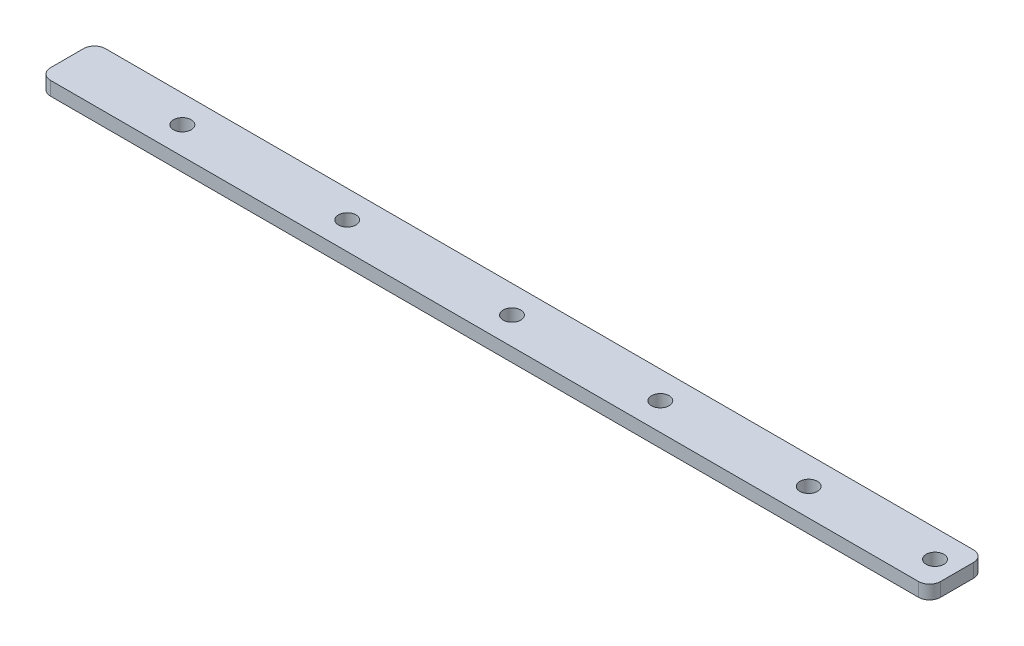
from build123d import *

# Parameters (mm, degrees)
SKETCH1_W           = 205.74
SKETCH1_H           = 12.7
BOSS_EXTRUDE1_DEPTH = 3.175
FILLET1_R           = 2.54
CUT_EXTRUDE1_REACH  = 105.115
SKETCH2_R           = 2.032


with BuildPart() as part:
    # Sketch1 → Boss-Extrude1 (new body)
    with BuildSketch(Plane(origin=(0, 0, 0), x_dir=(1, 0, 0), z_dir=(0, 1, 0))):
        Rectangle(SKETCH1_W, SKETCH1_H)
    extrude(amount=BOSS_EXTRUDE1_DEPTH)

    # Fillet1
    fillet1_edges = [part.edges().sort_by_distance(p)[0] for p in [
        (102.87, 1.5875, -6.35),
        (102.87, 1.5875, 6.35),
        (-102.87, 1.5875, 6.35),
        (-102.87, 1.5875, -6.35),
    ]]
    fillet(fillet1_edges, radius=FILLET1_R)

    # Sketch2 → Cut-Extrude1 (cut, up to next)
    with BuildSketch(Plane(origin=(0, 3.175, 0), x_dir=(1, 0, 0), z_dir=(0, 1, 0)), mode=Mode.PRIVATE) as cut_extrude1_sk1:
        with Locations((-76.2, 0)):
            Circle(SKETCH2_R)
    cut_extrude1_tool1 = extrude(cut_extrude1_sk1.sketch, amount=-CUT_EXTRUDE1_REACH, mode=Mode.PRIVATE) & part.part
    # Sketch2 → Cut-Extrude1 (cut, up to next)
    with BuildSketch(Plane(origin=(0, 3.175, 0), x_dir=(1, 0, 0), z_dir=(0, 1, 0)), mode=Mode.PRIVATE) as cut_extrude1_sk2:
        Circle(SKETCH2_R)
    cut_extrude1_tool2 = extrude(cut_extrude1_sk2.sketch, amount=-CUT_EXTRUDE1_REACH, mode=Mode.PRIVATE) & part.part
    # Sketch2 → Cut-Extrude1 (cut, up to next)
    with BuildSketch(Plane(origin=(0, 3.175, 0), x_dir=(1, 0, 0), z_dir=(0, 1, 0)), mode=Mode.PRIVATE) as cut_extrude1_sk3:
        with Locations((-38.1, 0)):
            Circle(SKETCH2_R)
    cut_extrude1_tool3 = extrude(cut_extrude1_sk3.sketch, amount=-CUT_EXTRUDE1_REACH, mode=Mode.PRIVATE) & part.part
    # Sketch2 → Cut-Extrude1 (cut, up to next)
    with BuildSketch(Plane(origin=(0, 3.175, 0), x_dir=(1, 0, 0), z_dir=(0, 1, 0)), mode=Mode.PRIVATE) as cut_extrude1_sk4:
        with Locations((97.79, 0)):
            Circle(SKETCH2_R)
    cut_extrude1_tool4 = extrude(cut_extrude1_sk4.sketch, amount=-CUT_EXTRUDE1_REACH, mode=Mode.PRIVATE) & part.part
    # Sketch2 → Cut-Extrude1 (cut, up to next)
    with BuildSketch(Plane(origin=(0, 3.175, 0), x_dir=(1, 0, 0), z_dir=(0, 1, 0)), mode=Mode.PRIVATE) as cut_extrude1_sk5:
        with Locations((68.58, 0)):
            Circle(SKETCH2_R)
    cut_extrude1_tool5 = extrude(cut_extrude1_sk5.sketch, amount=-CUT_EXTRUDE1_REACH, mode=Mode.PRIVATE) & part.part
    # Sketch2 → Cut-Extrude1 (cut, up to next)
    with BuildSketch(Plane(origin=(0, 3.175, 0), x_dir=(1, 0, 0), z_dir=(0, 1, 0)), mode=Mode.PRIVATE) as cut_extrude1_sk6:
        with Locations((34.29, 0)):
            Circle(SKETCH2_R)
    cut_extrude1_tool6 = extrude(cut_extrude1_sk6.sketch, amount=-CUT_EXTRUDE1_REACH, mode=Mode.PRIVATE) & part.part
    add(cut_extrude1_tool1.solids().sort_by_distance((-76.2, 3.175, 0))[0], mode=Mode.SUBTRACT)
    add(cut_extrude1_tool2.solids().sort_by_distance((0, 3.175, 0))[0], mode=Mode.SUBTRACT)
    add(cut_extrude1_tool3.solids().sort_by_distance((-38.1, 3.175, 0))[0], mode=Mode.SUBTRACT)
    add(cut_extrude1_tool4.solids().sort_by_distance((97.79, 3.175, 0))[0], mode=Mode.SUBTRACT)
    add(cut_extrude1_tool5.solids().sort_by_distance((68.58, 3.175, 0))[0], mode=Mode.SUBTRACT)
    add(cut_extrude1_tool6.solids().sort_by_distance((34.29, 3.175, 0))[0], mode=Mode.SUBTRACT)


solid = part.part
